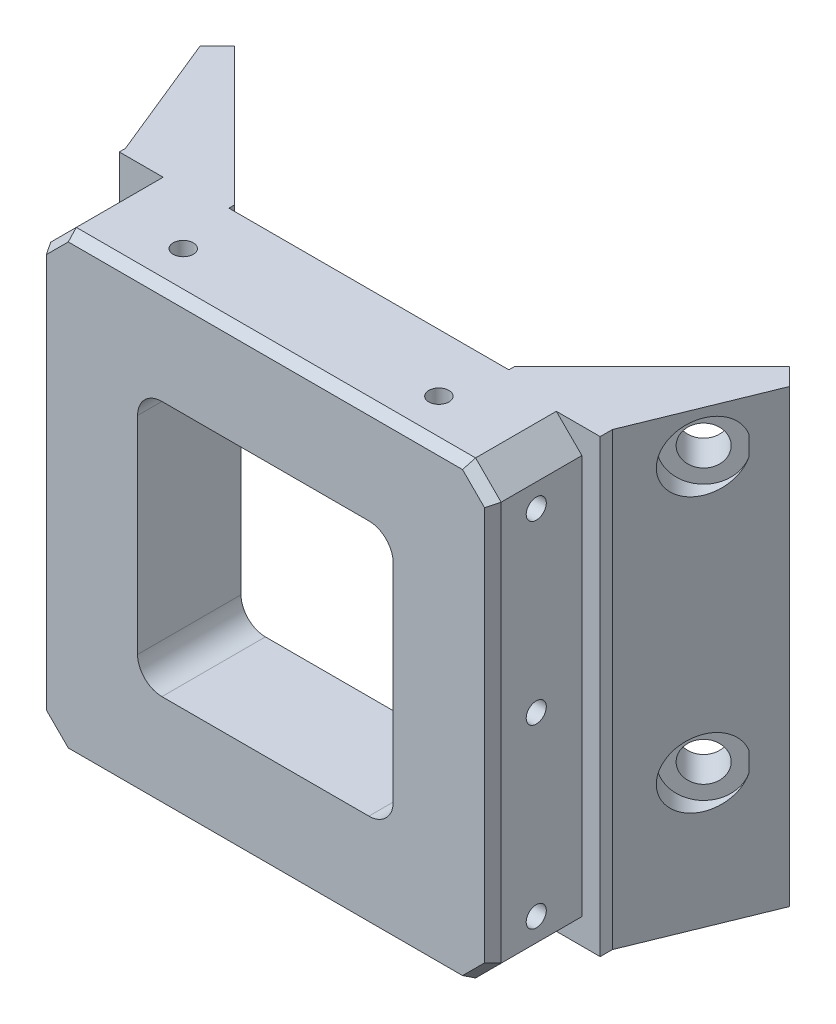
from build123d import *

# Parameters (mm, degrees)
BOSS_EXTRUDE1_DEPTH             = 37
BOSS_EXTRUDE1_DEPTH_BACK        = 37
SKETCH2_W                       = 74
SKETCH2_H                       = 74
BOSS_EXTRUDE2_DEPTH             = 15
ADVANCEDHOLE1_START             = 20.194913472
ADVANCEDHOLE1_DEPTH             = 4.525323154
ADVANCEDHOLE1_START_2           = 14.194913472
ADVANCEDHOLE1_2_OUTLINE_R       = 3.2
ADVANCEDHOLE1_2_DEPTH           = 6
ADVANCEDHOLE2_START             = -24.720236626
ADVANCEDHOLE2_DEPTH             = 4.525323154
ADVANCEDHOLE2_START_2           = -20.194913472
ADVANCEDHOLE2_2_OUTLINE_R       = 3.2
ADVANCEDHOLE2_2_DEPTH           = 6
SKETCH11_W                      = 3
SKETCH11_H                      = 74
CUT_EXTRUDE1_DEPTH              = 1
M4_TAPPED_HOLE1_D               = 3.3
M4_TAPPED_HOLE1_DEPTH           = 10.1
M4_TAPPED_HOLE1_TIP             = 0.991420021
M4_TAPPED_HOLE1_ON_FACE_2_D     = 3.3
M4_TAPPED_HOLE1_ON_FACE_2_DEPTH = 10.1
M4_TAPPED_HOLE1_ON_FACE_2_TIP   = 0.991420021
M4_TAPPED_HOLE1_ON_FACE_3_D     = 3.3
M4_TAPPED_HOLE1_ON_FACE_3_DEPTH = 10.1
M4_TAPPED_HOLE1_ON_FACE_3_TIP   = 0.991420021
M4_TAPPED_HOLE1_ON_FACE_4_D     = 3.3
M4_TAPPED_HOLE1_ON_FACE_4_DEPTH = 10.1
M4_TAPPED_HOLE1_ON_FACE_4_TIP   = 0.991420021
CHAMFER1_SIZE                   = 4.2
CHAMFER2_SIZE                   = 1
CHAMFER2_SIZE2                  = 1.732050808
CUT_EXTRUDE2_DEPTH              = 74.199110283


# Read off the part's stored shape, not the designer's step: AdvancedHole1, AdvancedHole2
with BuildPart() as part:
    # Sketch1 → Boss-Extrude1 (new, two sides: drawn at the far end of the back side and taken through both)
    with BuildSketch(Plane(origin=(0, 0, 0), x_dir=(1, 0, 0), z_dir=(0, 1, 0)).offset(-BOSS_EXTRUDE1_DEPTH_BACK)):
        Polygon((-40, 2), (-48.436814511, 22.705321112), (-45.608387387, 25.533748237), (-23, 2.925360851), (-23, 2), (23, 2), (23, 2.925360851), (45.608387387, 25.533748237), (48.436814511, 22.705321112), (40, 2), (40, 0), (-40, 0), align=None)
    extrude(amount=BOSS_EXTRUDE1_DEPTH + BOSS_EXTRUDE1_DEPTH_BACK)

    # Sketch2 → Boss-Extrude2 (add)
    with BuildSketch(Plane.XY):
        Rectangle(SKETCH2_W, SKETCH2_H)
    extrude(amount=BOSS_EXTRUDE2_DEPTH)

    # AdvancedHole1 outline → AdvancedHole1 (cut)
    with BuildSketch(Plane(origin=(0, 0, 0), x_dir=(0.707106781186546, 0, -0.707106781186549), z_dir=(0.707106781186549, 0, 0.707106781186546)).offset(ADVANCEDHOLE1_START)):
        with BuildLine():
            Line((45.554363955, 28.35832814), (46.067784427, 30))
            Line((46.067784427, 30), (45.554363955, 31.64167186))
            ThreePointArc((45.554363955, 31.64167186), (34.805086528, 30), (45.554363955, 28.35832814))
        make_face()
        with BuildLine():
            ThreePointArc((45.554363955, -13.35832814), (34.805086528, -15), (45.554363955, -16.64167186))
            Line((45.554363955, -16.64167186), (46.067784427, -15))
            Line((46.067784427, -15), (45.554363955, -13.35832814))
        make_face()
    extrude(amount=ADVANCEDHOLE1_DEPTH, mode=Mode.SUBTRACT)

    # AdvancedHole1 2 outline → AdvancedHole1 2 (cut)
    with BuildSketch(Plane(origin=(0, 0, 0), x_dir=(0.707106781186546, 0, -0.707106781186549), z_dir=(0.707106781186549, 0, 0.707106781186546)).offset(ADVANCEDHOLE1_START_2)):
        with Locations((40.305086528, -15)):
            Circle(ADVANCEDHOLE1_2_OUTLINE_R)
        with Locations((40.305086528, 30)):
            Circle(ADVANCEDHOLE1_2_OUTLINE_R)
    extrude(amount=ADVANCEDHOLE1_2_DEPTH, mode=Mode.SUBTRACT)

    # AdvancedHole2 outline → AdvancedHole2 (cut)
    with BuildSketch(Plane(origin=(0, 0, 0), x_dir=(0.707106781186546, 0, 0.707106781186549), z_dir=(0.707106781186549, 0, -0.707106781186546)).offset(ADVANCEDHOLE2_START)):
        with BuildLine():
            Line((-46.067784427, 15), (-45.554363955, 13.35832814))
            ThreePointArc((-45.554363955, 13.35832814), (-34.805086528, 15), (-45.554363955, 16.64167186))
            Line((-45.554363955, 16.64167186), (-46.067784427, 15))
        make_face()
        with BuildLine():
            Line((-45.554363955, -28.35832814), (-46.067784427, -30))
            Line((-46.067784427, -30), (-45.554363955, -31.64167186))
            ThreePointArc((-45.554363955, -31.64167186), (-34.805086528, -30), (-45.554363955, -28.35832814))
        make_face()
    extrude(amount=ADVANCEDHOLE2_DEPTH, mode=Mode.SUBTRACT)

    # AdvancedHole2 2 outline → AdvancedHole2 2 (cut)
    with BuildSketch(Plane(origin=(0, 0, 0), x_dir=(0.707106781186546, 0, 0.707106781186549), z_dir=(0.707106781186549, 0, -0.707106781186546)).offset(ADVANCEDHOLE2_START_2)):
        with Locations((-40.305086528, 15)):
            Circle(ADVANCEDHOLE2_2_OUTLINE_R)
        with Locations((-40.305086528, -30)):
            Circle(ADVANCEDHOLE2_2_OUTLINE_R)
    extrude(amount=ADVANCEDHOLE2_2_DEPTH, mode=Mode.SUBTRACT)

    # Sketch11 → Cut-Extrude1 (cut)
    with BuildSketch(Plane.XY):
        with Locations((-38.5, 0)):
            Rectangle(SKETCH11_W, SKETCH11_H)
    extrude(amount=-CUT_EXTRUDE1_DEPTH, mode=Mode.SUBTRACT)

    # M4 Tapped Hole1
    with Locations(Plane(origin=(37, 29, 7.5), x_dir=(0, 0, 1), z_dir=(1, 0, 0))):
        with Locations((0, 0), (0, 58), (0, 29)):
            Hole(M4_TAPPED_HOLE1_D / 2, depth=M4_TAPPED_HOLE1_DEPTH)
            with Locations((0, 0, -(M4_TAPPED_HOLE1_DEPTH + M4_TAPPED_HOLE1_TIP / 2))):  # 118° drill point
                Cone(0, M4_TAPPED_HOLE1_D / 2, M4_TAPPED_HOLE1_TIP, mode=Mode.SUBTRACT)

    # M4 Tapped Hole1 on face 2
    with Locations(Plane(origin=(-37, 29, 7.5), x_dir=(0, 0, -1), z_dir=(-1, 0, 0))):
        with Locations((0, 0), (0, 58), (0, 29)):
            Hole(M4_TAPPED_HOLE1_ON_FACE_2_D / 2, depth=M4_TAPPED_HOLE1_ON_FACE_2_DEPTH)
            with Locations((0, 0, -(M4_TAPPED_HOLE1_ON_FACE_2_DEPTH + M4_TAPPED_HOLE1_ON_FACE_2_TIP / 2))):  # 118° drill point
                Cone(0, M4_TAPPED_HOLE1_ON_FACE_2_D / 2, M4_TAPPED_HOLE1_ON_FACE_2_TIP, mode=Mode.SUBTRACT)

    # M4 Tapped Hole1 on face 3
    with Locations(Plane(origin=(21, 37, 7.5), x_dir=(0, 0, 1), z_dir=(0, 1, 0))):
        with Locations((0, 0), (0, -42)):
            Hole(M4_TAPPED_HOLE1_ON_FACE_3_D / 2, depth=M4_TAPPED_HOLE1_ON_FACE_3_DEPTH)
            with Locations((0, 0, -(M4_TAPPED_HOLE1_ON_FACE_3_DEPTH + M4_TAPPED_HOLE1_ON_FACE_3_TIP / 2))):  # 118° drill point
                Cone(0, M4_TAPPED_HOLE1_ON_FACE_3_D / 2, M4_TAPPED_HOLE1_ON_FACE_3_TIP, mode=Mode.SUBTRACT)

    # M4 Tapped Hole1 on face 4
    with Locations(Plane(origin=(-21, -37, 7.5), x_dir=(0, 0, -1), z_dir=(0, -1, 0))):
        with Locations((0, 0), (0, 42)):
            Hole(M4_TAPPED_HOLE1_ON_FACE_4_D / 2, depth=M4_TAPPED_HOLE1_ON_FACE_4_DEPTH)
            with Locations((0, 0, -(M4_TAPPED_HOLE1_ON_FACE_4_DEPTH + M4_TAPPED_HOLE1_ON_FACE_4_TIP / 2))):  # 118° drill point
                Cone(0, M4_TAPPED_HOLE1_ON_FACE_4_D / 2, M4_TAPPED_HOLE1_ON_FACE_4_TIP, mode=Mode.SUBTRACT)

    # Chamfer1
    chamfer1_edges = [part.edges().sort_by_distance(p)[0] for p in [
        (37, -37, 7.5),
        (37, 37, 7.5),
        (-37, 37, 7),
        (-37, -37, 7),
    ]]
    chamfer(chamfer1_edges, length=CHAMFER1_SIZE)

    # Chamfer2
    chamfer2_edges = [part.edges().sort_by_distance(p)[0] for p in [
        (37, 0, 15),
        (0, -37, 15),
        (0, 37, 15),
        (-37, 0, 15),
        (34.9, 34.9, 15),
        (-34.9, 34.9, 15),
        (-34.9, -34.9, 15),
        (34.9, -34.9, 15),
    ]]
    chamfer2_side = [part.faces().sort_by_distance(p)[0] for p in [
        (0, 0, 15),
    ]]
    chamfer(chamfer2_edges, length=CHAMFER2_SIZE, length2=CHAMFER2_SIZE2, reference=chamfer2_side[0])

    # Sketch13 → Cut-Extrude2 (cut, through all)
    with BuildSketch(Plane.XY.offset(15)):
        with BuildLine():
            Line((-21, 17), (-21, -17))
            ThreePointArc((-21, -17), (-19.828427125, -19.828427125), (-17, -21))
            Line((-17, -21), (17, -21))
            ThreePointArc((17, -21), (19.828427125, -19.828427125), (21, -17))
            Line((21, -17), (21, 17))
            ThreePointArc((21, 17), (19.828427125, 19.828427125), (17, 21))
            Line((17, 21), (-17, 21))
            ThreePointArc((-17, 21), (-19.828427125, 19.828427125), (-21, 17))
        make_face()
    extrude(amount=-CUT_EXTRUDE2_DEPTH, mode=Mode.SUBTRACT)


solid = part.part
